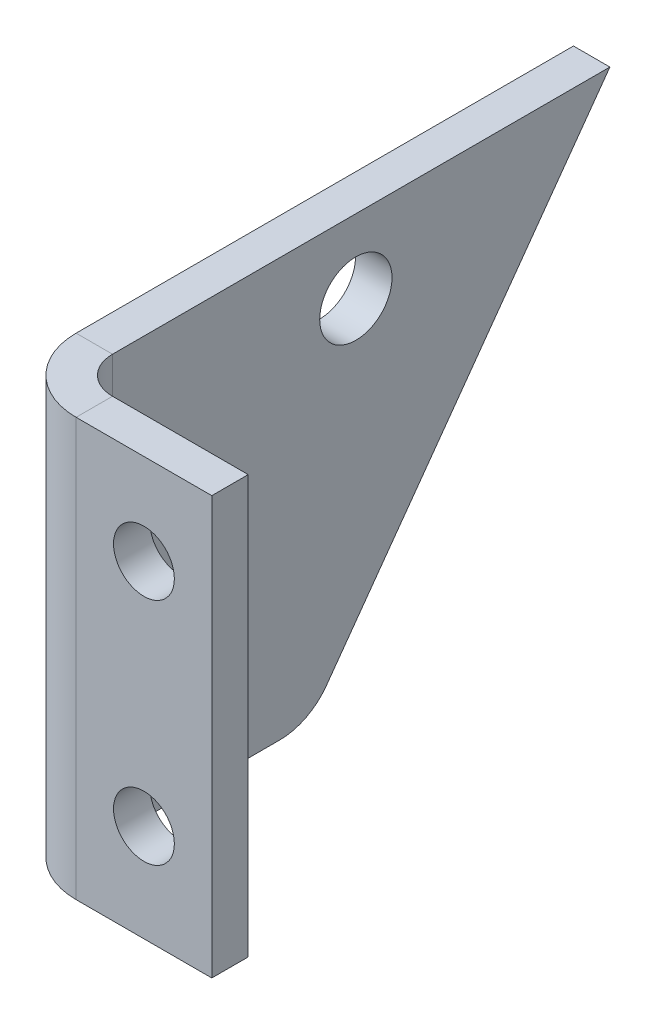
from build123d import *

# Parameters (mm, degrees)
BASE_FLANGE1_DEPTH           = 3.175
SKETCH7_R                    = 3.15
CUT_EXTRUDE3_DEPTH           = 10
EDGE_FLANGE1_STRIP_W         = 19.05
EDGE_FLANGE1_STRIP_H         = 3.175
EDGE_FLANGE1_STRIP_CUT_DEPTH = 36.40397533
EDGE_FLANGE1_DEPTH           = 36.40397533
SKETCH12_R                   = 2.65
CUT_EXTRUDE4_DEPTH           = 10


# Sheet-metal steps are written as plain solids
with BuildPart() as part:
    # Sketch2 → Base-Flange1 (new body)
    with BuildSketch(Plane(origin=(0, 0, 0), x_dir=(0, 0, -1), z_dir=(1, 0, 0))):
        with BuildLine():
            Line((0, 0), (0, 36.40397533))
            Line((0, 36.40397533), (49.693245392, 36.40397533))
            Line((49.693245392, 36.40397533), (24.989293369, 2.07924376))
            ThreePointArc((24.989293369, 2.07924376), (23.211005522, 0.550068473), (20.931069251, 0))
            Line((20.931069251, 0), (0, 0))
        make_face()
    extrude(amount=-BASE_FLANGE1_DEPTH)

    # Sketch7 → Cut-Extrude3 (cut)
    with BuildSketch(Plane.ZY.offset(3.175)):
        with Locations((-27.553898694, 30)):
            Circle(SKETCH7_R)
        with Locations((-12.587671369, 10)):
            Circle(SKETCH7_R)
    extrude(amount=-CUT_EXTRUDE3_DEPTH, mode=Mode.SUBTRACT)

    # Edge-Flange1 strip (across the edge) → Edge-Flange1 strip cut (cut)
    with BuildSketch(Plane(origin=(0, 36.40397533, 0), x_dir=(0, 0, -1), z_dir=(0, -1, 0))):
        with Locations((-3.175, -1.5875)):
            Rectangle(EDGE_FLANGE1_STRIP_W, EDGE_FLANGE1_STRIP_H)
    extrude(amount=EDGE_FLANGE1_STRIP_CUT_DEPTH, mode=Mode.SUBTRACT)

    # Edge-Flange1 section (across the edge) → Edge-Flange1 (add)
    with BuildSketch(Plane(origin=(0, 36.40397533, 0), x_dir=(0, 0, -1), z_dir=(0, -1, 0))):
        with BuildLine():
            Line((0, 3.175), (0, 15))
            Line((0, 15), (3.175, 15))
            Line((3.175, 15), (3.175, 3.175))
            ThreePointArc((3.175, 3.175), (4.10493597, 0.92993597), (6.35, 0))
            Line((6.35, 0), (6.35, -3.175))
            ThreePointArc((6.35, -3.175), (1.859871939, -1.315128061), (0, 3.175))
        make_face()
    extrude(amount=EDGE_FLANGE1_DEPTH)

    # Sketch12 → Cut-Extrude4 (cut)
    with BuildSketch(Plane(origin=(0, 0, -3.175), x_dir=(-1, 0, 0), z_dir=(0, 0, -1))):
        with Locations((-9.0875, 28.496416241)):
            Circle(SKETCH12_R)
        with Locations((-9.0875, 8.49661674)):
            Circle(SKETCH12_R)
    extrude(amount=-CUT_EXTRUDE4_DEPTH, mode=Mode.SUBTRACT)


solid = part.part
